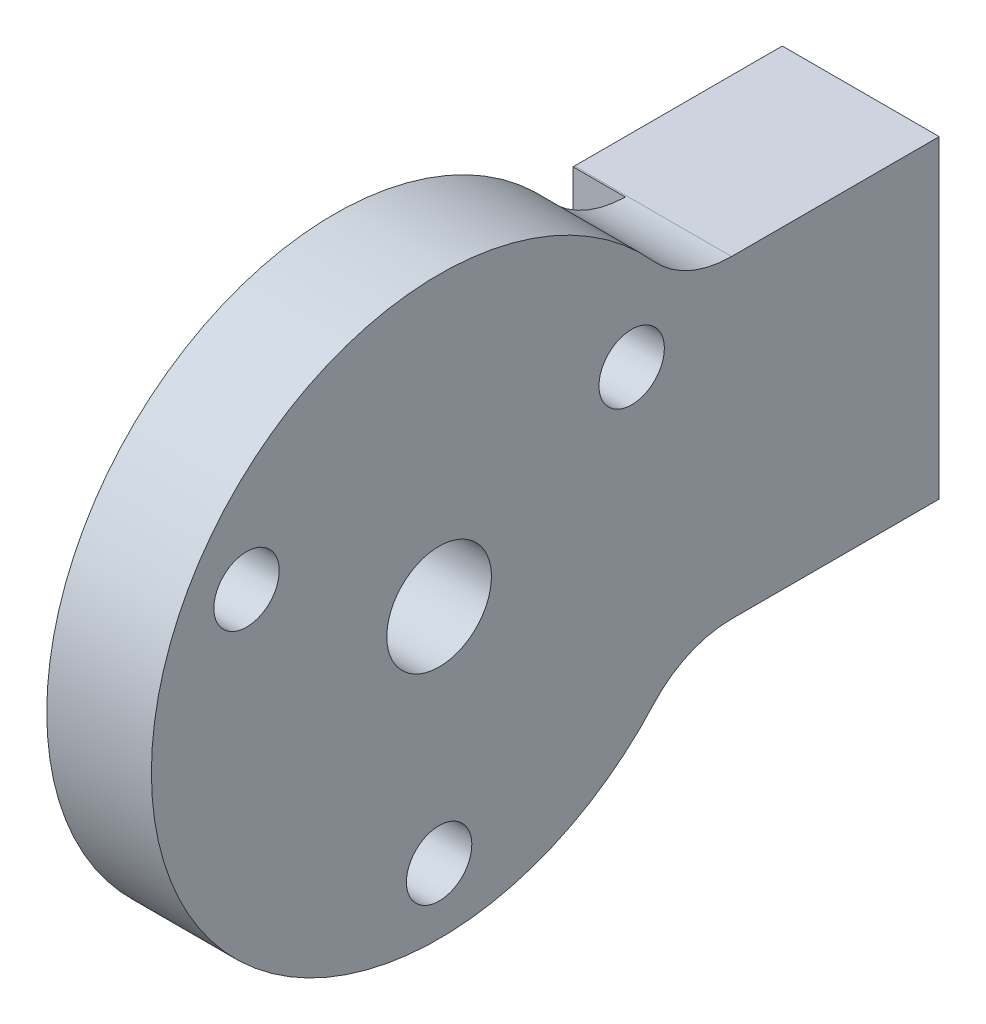
from build123d import *

# Parameters (mm, degrees)
SKETCH1_W             = 6
SKETCH1_H             = 12
EXTRUDE1_DEPTH        = 8
SKETCH3_W             = 4
SKETCH3_H             = 8.6
EXTRUDE2_DEPTH        = 1
SKETCH2_R             = 1.25
EXTRUDE3_DEPTH        = 6
EXTRUDE4_DEPTH        = 4
SKETCH6_R             = 5.25
EXTRUDE5_DEPTH        = 1
SKETCH7_R             = 1.25
EXTRUDE6_DEPTH        = 4
CIRPATTERN1_COUNT     = 3
SKETCH8_R             = 2
EXTRUDE7_DEPTH        = 3
FILLET1_R             = 4
M3_TAPPED_HOLE1_D     = 2.5
M3_TAPPED_HOLE1_DEPTH = 6
M3_TAPPED_HOLE1_TIP   = 0.751075774


with BuildPart() as part:
    # Sketch1 → Extrude1 (new body)
    with BuildSketch(Plane.XY):
        with Locations((-1, 0)):
            Rectangle(SKETCH1_W, SKETCH1_H)
    extrude(amount=EXTRUDE1_DEPTH)

    # Sketch3 → Extrude2 (add)
    with BuildSketch(Plane.XY.offset(8)):
        Rectangle(SKETCH3_W, SKETCH3_H)
    extrude(amount=EXTRUDE2_DEPTH)

    # Sketch2 → Extrude3 (cut)
    with BuildSketch(Plane(origin=(0, 0, 0), x_dir=(-1, 0, 0), z_dir=(0, 0, -1))):
        with Locations((1, 3)):
            Circle(SKETCH2_R)
        with Locations((1, -3)):
            Circle(SKETCH2_R)
    extrude(amount=-EXTRUDE3_DEPTH, mode=Mode.SUBTRACT)

    # Sketch4 → Extrude4 (add)
    with BuildSketch(Plane(origin=(2, 0, 0), x_dir=(0, 0, -1), z_dir=(1, 0, 0))):
        with BuildLine():
            Line((-9.900455543, 6), (-8, 6))
            Line((-8, 6), (-8, -6))
            Line((-8, -6), (-9.900455543, -6))
            ThreePointArc((-9.900455543, -6), (-30.12, 0), (-9.900455543, 6))
        make_face()
    extrude(amount=-EXTRUDE4_DEPTH)

    # Sketch6 → Extrude5 (cut)
    with BuildSketch(Plane.ZY.offset(2)):
        with Locations(Location((19.12, 0, 0), (0, 0, 270))):
            Circle(SKETCH6_R)
    extrude(amount=-EXTRUDE5_DEPTH, mode=Mode.SUBTRACT)

    # Sketch7 → Extrude6 (cut)
    with BuildSketch(Plane.ZY.offset(2)):
        with Locations(Location((19.12, -8.5, 0), (0, 0, 270))):
            Circle(SKETCH7_R)
    extrude6 = extrude(amount=-EXTRUDE6_DEPTH, mode=Mode.SUBTRACT)

    # CirPattern1: Extrude6 ×3 about axis
    cirpattern1_axis = Axis((0, 0, 19.12), (1, 0, 0))
    for i in range(1, CIRPATTERN1_COUNT):
        add(extrude6.rotate(cirpattern1_axis, i * 360 / CIRPATTERN1_COUNT), mode=Mode.SUBTRACT)

    # Sketch8 → Extrude7 (cut)
    with BuildSketch(Plane.ZY.offset(1)):
        with Locations(Location((19.12, 0, 0), (0, 0, 270))):
            Circle(SKETCH8_R)
    extrude(amount=-EXTRUDE7_DEPTH, mode=Mode.SUBTRACT)

    # Fillet1
    # the kernel refuses this fillet: 4 mm, written as the material it adds along each edge
    with BuildSketch(Plane(origin=(2, 6, 9.900455543), x_dir=(0, 0, -1), z_dir=(-1, 0, 0))) as fillet1_piece_1_section:
        with BuildLine():
            CenterArc((1.96079543, -4), FILLET1_R, 90, 48.189685104)
            ThreePointArc((-1.02062854, -1.333333333), (-0.484835824, -0.686169688), (0, 0))
            Line((0, 0), (1.96079543, 0))
        make_face()
    fillet1_piece_1 = extrude(amount=4, mode=Mode.PRIVATE)
    fillet1_piece_1 = split(fillet1_piece_1, bisect_by=Plane(origin=(0, 5.96007597, 8), z_dir=(0, 0, -1)), keep=Keep.TOP, mode=Mode.PRIVATE)
    add(fillet1_piece_1)
    with BuildSketch(Plane(origin=(2, 6, 9.900455543), x_dir=(0, 0, -1), z_dir=(-1, 0, 0))) as fillet1_piece_2_section:
        with BuildLine():
            CenterArc((1.96079543, -4), FILLET1_R, 90, 48.189685104)
            ThreePointArc((-1.02062854, -1.333333333), (-0.484835824, -0.686169688), (0, 0))
            Line((0, 0), (1.96079543, 0))
        make_face()
    fillet1_piece_2 = extrude(amount=4, mode=Mode.PRIVATE)
    fillet1_piece_2 = split(fillet1_piece_2, bisect_by=Plane(origin=(0, 6.284176822, 8), z_dir=(0, 0, 1)), keep=Keep.TOP, mode=Mode.PRIVATE)
    add(fillet1_piece_2)
    with BuildSketch(Plane(origin=(2, 6, 9.900455543), x_dir=(0, 0, -1), z_dir=(-1, 0, 0))) as fillet1_piece_3_section:
        with BuildLine():
            CenterArc((1.96079543, -4), FILLET1_R, 90, 48.189685104)
            ThreePointArc((-1.02062854, -1.333333333), (-0.484835824, -0.686169688), (0, 0))
            Line((0, 0), (1.96079543, 0))
        make_face()
    fillet1_piece_3 = extrude(amount=8.901988576, mode=Mode.PRIVATE)
    fillet1_piece_3 = split(fillet1_piece_3, bisect_by=Plane(origin=(-4, 5.96007597, 7.969858609), z_dir=(1, 0, 0)), keep=Keep.TOP, mode=Mode.PRIVATE)
    fillet1_piece_3 = split(fillet1_piece_3, bisect_by=Plane(origin=(-3, 5.96007597, 8), z_dir=(0, 0, -1)), keep=Keep.TOP, mode=Mode.PRIVATE)
    fillet1_piece_3 = split(fillet1_piece_3, bisect_by=Plane(origin=(-2, 5.96007597, 7.969858609), z_dir=(-1, 0, 0)), keep=Keep.TOP, mode=Mode.PRIVATE)
    add(fillet1_piece_3)
    with BuildSketch(Plane(origin=(2, -6, 9.900455543), x_dir=(0, -0.794064421171895, 0.6078336080120474), z_dir=(-1, 0, 0))) as fillet1_piece_4_section:
        with BuildLine():
            CenterArc((1.984420324, -3.98833232), FILLET1_R, 94.377291872, 48.189685104)
            Line((-1.191837361, -1.556997888), (0, 0))
            ThreePointArc((0, 0), (0.839562445, -0.032086119), (1.679124889, 0))
        make_face()
    fillet1_piece_4 = extrude(amount=4, mode=Mode.PRIVATE)
    fillet1_piece_4 = split(fillet1_piece_4, bisect_by=Plane(origin=(0, -6.284176822, 8), z_dir=(0, 0, 1)), keep=Keep.TOP, mode=Mode.PRIVATE)
    add(fillet1_piece_4)
    with BuildSketch(Plane(origin=(2, -6, 9.900455543), x_dir=(0, -0.794064421171895, 0.6078336080120474), z_dir=(-1, 0, 0))) as fillet1_piece_5_section:
        with BuildLine():
            CenterArc((1.984420324, -3.98833232), FILLET1_R, 94.377291872, 48.189685104)
            Line((-1.191837361, -1.556997888), (0, 0))
            ThreePointArc((0, 0), (0.839562445, -0.032086119), (1.679124889, 0))
        make_face()
    fillet1_piece_5 = extrude(amount=4, mode=Mode.PRIVATE)
    fillet1_piece_5 = split(fillet1_piece_5, bisect_by=Plane(origin=(0, -5.96007597, 8), z_dir=(0, 0, -1)), keep=Keep.TOP, mode=Mode.PRIVATE)
    add(fillet1_piece_5)
    with BuildSketch(Plane(origin=(2, -6, 9.900455543), x_dir=(0, -0.794064421171895, 0.6078336080120474), z_dir=(-1, 0, 0))) as fillet1_piece_6_section:
        with BuildLine():
            CenterArc((1.984420324, -3.98833232), FILLET1_R, 94.377291872, 48.189685104)
            Line((-1.191837361, -1.556997888), (0, 0))
            ThreePointArc((0, 0), (0.839562445, -0.032086119), (1.679124889, 0))
        make_face()
    fillet1_piece_6 = extrude(amount=8.901988576, mode=Mode.PRIVATE)
    fillet1_piece_6 = split(fillet1_piece_6, bisect_by=Plane(origin=(-4, -5.96007597, 7.969858609), z_dir=(1, 0, 0)), keep=Keep.TOP, mode=Mode.PRIVATE)
    fillet1_piece_6 = split(fillet1_piece_6, bisect_by=Plane(origin=(-3, -5.96007597, 8), z_dir=(0, 0, -1)), keep=Keep.TOP, mode=Mode.PRIVATE)
    fillet1_piece_6 = split(fillet1_piece_6, bisect_by=Plane(origin=(-2, -5.96007597, 7.969858609), z_dir=(-1, 0, 0)), keep=Keep.TOP, mode=Mode.PRIVATE)
    add(fillet1_piece_6)

    # M3 Tapped Hole1
    with Locations(Plane(origin=(-1, 3, 0), x_dir=(-1, 0, 0), z_dir=(0, 0, -1))):
        with Locations((0, 0), (0, -6)):
            Hole(M3_TAPPED_HOLE1_D / 2, depth=M3_TAPPED_HOLE1_DEPTH)
            with Locations((0, 0, -(M3_TAPPED_HOLE1_DEPTH + M3_TAPPED_HOLE1_TIP / 2))):  # 118° drill point
                Cone(0, M3_TAPPED_HOLE1_D / 2, M3_TAPPED_HOLE1_TIP, mode=Mode.SUBTRACT)


solid = part.part
